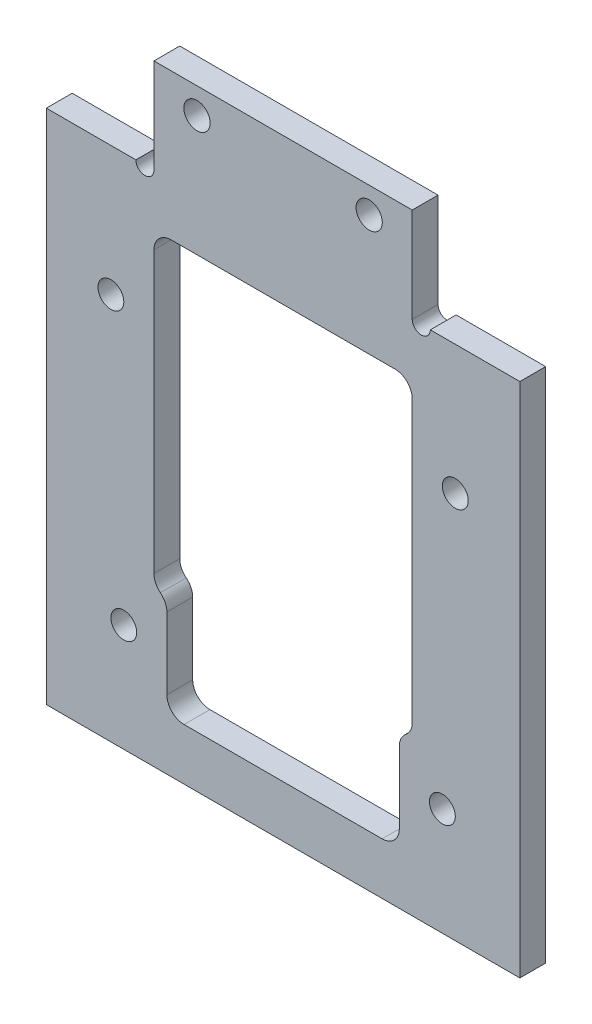
from build123d import *

# Parameters (mm, degrees)
SKETCH_1_W          = 55
SKETCH_1_H          = 60
EXTRUDE_1_DEPTH     = 3
SKETCH_2_W          = 30
SKETCH_2_H          = 22
EXTRUDE_2_DEPTH     = 3
SKETCH_3_R          = 1.05
CUT_EXTRUDE_1_DEPTH = 3
SKETCH_4_R          = 1.525
CUT_EXTRUDE_2_DEPTH = 3
SKETCH_5_R          = 1.5
CUT_EXTRUDE_3_DEPTH = 10
SKETCH_6_R          = 1.5
CUT_EXTRUDE_4_DEPTH = 10
CUT_EXTRUDE_5_DEPTH = 10
FILLET_1_R          = 2
FILLET_2_R          = 2


with BuildPart() as part:
    # 草图1 → 凸台-拉伸1 (new body)
    with BuildSketch(Plane.XY):
        Rectangle(SKETCH_1_W, SKETCH_1_H)
    extrude(amount=EXTRUDE_1_DEPTH)

    # 草图2 → 凸台-拉伸2 (add)
    with BuildSketch(Plane(origin=(0, 0, 0), x_dir=(-1, 0, 0), z_dir=(0, 0, -1))):
        with Locations((0, 30)):
            Rectangle(SKETCH_2_W, SKETCH_2_H)
    extrude(amount=-EXTRUDE_2_DEPTH)

    # 草图3 → 切除-拉伸1 (cut)
    with BuildSketch(Plane(origin=(0, 0, 0), x_dir=(-1, 0, 0), z_dir=(0, 0, -1))):
        with Locations((-16.05, 30)):
            Circle(SKETCH_3_R)
        with Locations((16.05, 30)):
            Circle(SKETCH_3_R)
    extrude(amount=-CUT_EXTRUDE_1_DEPTH, mode=Mode.SUBTRACT)

    # 草图4 → 切除-拉伸2 (cut)
    with BuildSketch(Plane.XY.offset(3)):
        with Locations((-10, 38)):
            Circle(SKETCH_4_R)
        with Locations((10, 38)):
            Circle(SKETCH_4_R)
    extrude(amount=-CUT_EXTRUDE_2_DEPTH, mode=Mode.SUBTRACT)

    # 草图5 → 切除-拉伸3 (cut)
    with BuildSketch(Plane(origin=(0, 0, 0), x_dir=(-1, 0, 0), z_dir=(0, 0, -1))):
        with Locations((-18.5, -17.5)):
            Circle(SKETCH_5_R)
        with Locations((18.5, -17.5)):
            Circle(SKETCH_5_R)
    extrude(amount=-CUT_EXTRUDE_3_DEPTH, mode=Mode.SUBTRACT)

    # 草图6 → 切除-拉伸4 (cut)
    with BuildSketch(Plane.XY.offset(3)):
        with Locations((20, 15)):
            Circle(SKETCH_6_R)
        with Locations((-20, 15)):
            Circle(SKETCH_6_R)
    extrude(amount=-CUT_EXTRUDE_4_DEPTH, mode=Mode.SUBTRACT)

    # 草图7 → 切除-拉伸5 (cut)
    with BuildSketch(Plane.XY.offset(3)):
        Polygon((-15, 24), (15, 24), (15, -12.5), (13.5, -12.5), (13.5, -24), (-13.5, -24), (-13.5, -12.5), (-15, -12.5), align=None)
    extrude(amount=-CUT_EXTRUDE_5_DEPTH, mode=Mode.SUBTRACT)

    # 圆角1
    # the kernel refuses this fillet: 2 mm, written as the material it adds along each edge
    with BuildSketch(Plane(origin=(-15, 24, 3), x_dir=(0, -1, 0), z_dir=(0, 0, -1))) as fillet_1_piece_1:
        with BuildLine():
            CenterArc((FILLET_1_R, -FILLET_1_R), FILLET_1_R, 90, 90)
            Line((0, -FILLET_1_R), (-FILLET_1_R * 0.02, -FILLET_1_R))
            Line((-FILLET_1_R * 0.02, -FILLET_1_R), (-FILLET_1_R * 0.02, FILLET_1_R * 0.02))
            Line((-FILLET_1_R * 0.02, FILLET_1_R * 0.02), (FILLET_1_R, FILLET_1_R * 0.02))
            Line((FILLET_1_R, FILLET_1_R * 0.02), (FILLET_1_R, 0))
        make_face()
    extrude(amount=3)
    with BuildSketch(Plane(origin=(15, 24, 3), x_dir=(0, -1, 0), z_dir=(0, 0, -1)), Plane(origin=(-13.5, -24, 3), x_dir=(0, 1, 0), z_dir=(0, 0, -1)), Plane(origin=(13.5, -24, 3), x_dir=(-1, 0, 0), z_dir=(0, 0, -1))) as fillet_1_piece_2:
        with BuildLine():
            CenterArc((FILLET_1_R, FILLET_1_R), FILLET_1_R, 180, 90)
            Line((0, FILLET_1_R), (-FILLET_1_R * 0.02, FILLET_1_R))
            Line((-FILLET_1_R * 0.02, FILLET_1_R), (-FILLET_1_R * 0.02, -FILLET_1_R * 0.02))
            Line((-FILLET_1_R * 0.02, -FILLET_1_R * 0.02), (FILLET_1_R, -FILLET_1_R * 0.02))
            Line((FILLET_1_R, -FILLET_1_R * 0.02), (FILLET_1_R, 0))
        make_face()
    extrude(amount=3)
    with BuildSketch(Plane(origin=(15, -12.5, 3), x_dir=(-1, 0, 0), z_dir=(0, 0, -1))) as fillet_1_piece_3:
        with BuildLine():
            CenterArc((2, 1.936491673), FILLET_1_R, 180, 75.522487814)
            Line((0, 1.936491673), (-0.04, 1.936491673))
            Line((-0.04, 1.936491673), (-0.04, 0))
            Line((-0.04, 0), (0, -0.04))
            ThreePointArc((0, -0.04), (0.75, -0.04), (1.49, -0.038729833))
            Line((1.49, -0.038729833), (1.5, 0))
        make_face()
    extrude(amount=3)
    with BuildSketch(Plane(origin=(-15, -12.5, 3), x_dir=(0, 1, 0), z_dir=(0, 0, -1))) as fillet_1_piece_4:
        with BuildLine():
            CenterArc((1.936491673, 2), FILLET_1_R, 194.477512186, 75.522487814)
            Line((0, 1.5), (-0.038729833, 1.49))
            ThreePointArc((-0.038729833, 1.49), (-0.04, 0.75), (-0.04, 0))
            Line((-0.04, 0), (0, -0.04))
            Line((0, -0.04), (1.936491673, -0.04))
            Line((1.936491673, -0.04), (1.936491673, 0))
        make_face()
    extrude(amount=3)

    # 圆角2
    fillet_2_edges = [part.edges().sort_by_distance(p)[0] for p in [
        (13.5, -12.5, 1.5),
        (-13.5, -12.5, 1.5),
    ]]
    fillet(fillet_2_edges, radius=FILLET_2_R)


solid = part.part
